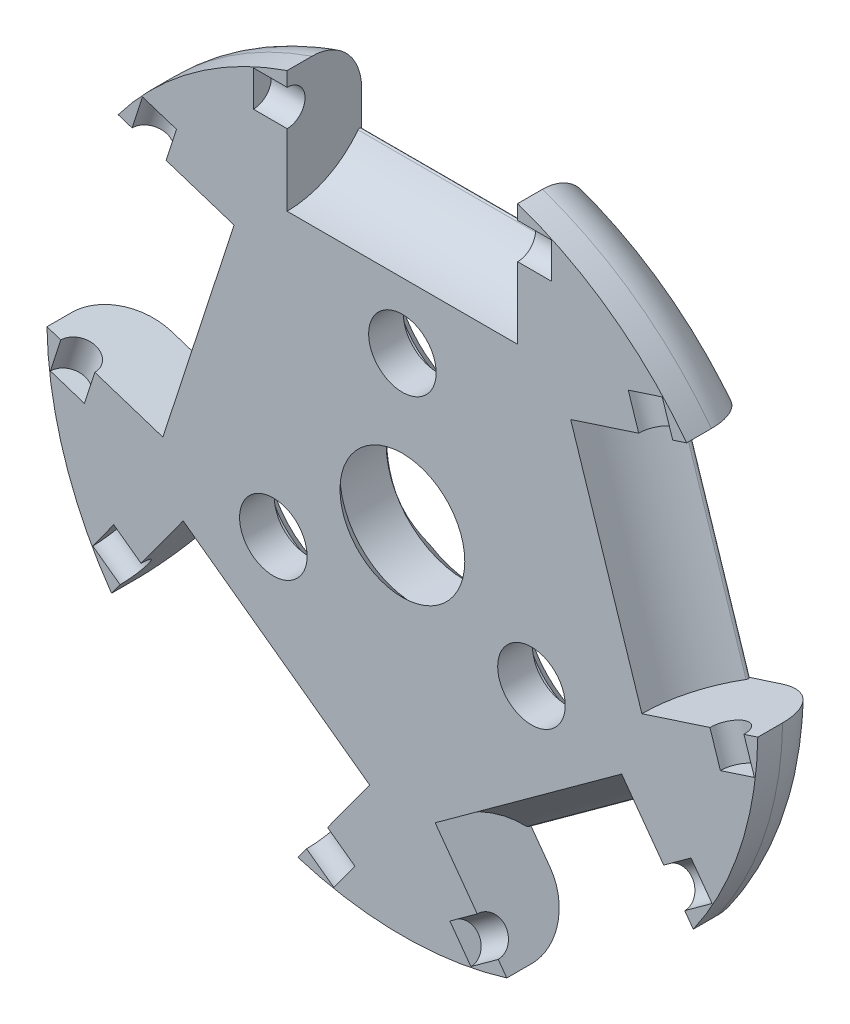
from build123d import *

# Parameters (mm, degrees)
SKETCH1_R                = 22.7203
BOSS_EXTRUDE2_DEPTH      = 4.7625
FILLET1_R                = 3.175
SKETCH2_W                = 14.732
SKETCH2_H                = 10.414
CUT_EXTRUDE2_DEPTH       = 12.7
CIRPATTERN1_COUNT        = 5
SKETCH4_R                = 1.143
CUT_EXTRUDE4_DEPTH       = 9.525
CIRPATTERN2_COUNT        = 5
SKETCH5_R                = 3.96875
CUT_EXTRUDE5_DEPTH       = 33.480350535
SKETCH6_R                = 2.159
CUT_EXTRUDE7_DEPTH       = 33.480350535
BOSS_EXTRUDE4_REACH      = 39.999
FILLET2_R                = 0.127
CIRPATTERN5_COUNT        = 5
FILLET2_OF_CIRPATTERN5_R = 0.127
SKETCH7_R                = 4.445
CUT_EXTRUDE8_DEPTH       = 2.54
SKETCH12_R               = 5.0038
CUT_EXTRUDE9_DEPTH       = 3.9878
CHAMFER1_SIZE            = 0.79375
CHAMFER2_SIZE            = 0.79375


with BuildPart() as part:
    # Sketch1 → Boss-Extrude2 (new body)
    with BuildSketch(Plane.XY):
        Circle(SKETCH1_R)
    extrude(amount=-BOSS_EXTRUDE2_DEPTH)

    # Fillet1
    fillet1_edges = [part.edges().sort_by_distance(p)[0] for p in [
        (-22.7203, 0, -4.7625),
    ]]
    fillet(fillet1_edges, radius=FILLET1_R)

    # Sketch2 → Cut-Extrude2 (cut)
    with BuildSketch(Plane.XY):
        with Locations((0, 18.7833)):
            Rectangle(SKETCH2_W, SKETCH2_H)
    cut_extrude2 = extrude(amount=-CUT_EXTRUDE2_DEPTH, mode=Mode.SUBTRACT)

    # CirPattern1: Cut-Extrude2 ×5 about axis
    cirpattern1_axis = Axis((0, 0, 0), (0, 0, 1))
    for i in range(1, CIRPATTERN1_COUNT):
        add(cut_extrude2.rotate(cirpattern1_axis, i * 360 / CIRPATTERN1_COUNT), mode=Mode.SUBTRACT)

    # Sketch4 → Cut-Extrude4 (cut, symmetric)
    with BuildSketch(Plane(origin=(0, 0, 0), x_dir=(0, 0, -1), z_dir=(1, 0, 0))):
        with Locations((0, 19.4183)):
            Circle(SKETCH4_R)
    cut_extrude4 = extrude(amount=CUT_EXTRUDE4_DEPTH, both=True, mode=Mode.SUBTRACT)

    # CirPattern2: Cut-Extrude4 ×5 about axis
    cirpattern2_axis = Axis((0, 0, 0), (0, 0, 1))
    for i in range(1, CIRPATTERN2_COUNT):
        add(cut_extrude4.rotate(cirpattern2_axis, i * 360 / CIRPATTERN2_COUNT), mode=Mode.SUBTRACT)

    # Sketch5 → Cut-Extrude5 (cut, through all)
    with BuildSketch(Plane.XY):
        Circle(SKETCH5_R)
    extrude(amount=-CUT_EXTRUDE5_DEPTH, mode=Mode.SUBTRACT)

    # Sketch6 → Cut-Extrude7 (cut, through all)
    with BuildSketch(Plane(origin=(0, 0, -4.7625), x_dir=(-1, 0, 0), z_dir=(0, 0, -1))):
        with Locations((0, 9.525)):
            Circle(SKETCH6_R)
        with Locations((8.248891971, -4.7625)):
            Circle(SKETCH6_R)
        with Locations((-8.248891971, -4.7625)):
            Circle(SKETCH6_R)
    extrude(amount=-CUT_EXTRUDE7_DEPTH, mode=Mode.SUBTRACT)

    # Sketch10 → Boss-Extrude4 (add, up to next)
    with BuildSketch(Plane.ZY.offset(-7.366), mode=Mode.PRIVATE) as boss_extrude4_sk1:
        with BuildLine():
            Line((-4.7625, 13.5763), (0, 13.5763))
            Line((0, 13.5763), (0, 13.7033))
            ThreePointArc((0, 13.7033), (-2.7025038, 14.38265722), (-4.7625, 16.259214887))
            Line((-4.7625, 16.259214887), (-4.7625, 13.5763))
        make_face()
    boss_extrude4_tool1 = extrude(boss_extrude4_sk1.sketch, amount=BOSS_EXTRUDE4_REACH, mode=Mode.PRIVATE) - part.part
    boss_extrude4 = boss_extrude4_tool1.solids().sort_by_distance((7.366, 14.314807, -3.452063))[0]
    add(boss_extrude4)

    # Fillet2
    fillet2_edges = [part.edges().sort_by_distance(p)[0] for p in [
        (0, 16.259214887, -4.7625),
    ]]
    fillet(fillet2_edges, radius=FILLET2_R)

    # CirPattern5: Boss-Extrude4 ×5 about axis
    cirpattern5_axis = Axis((0, 0, 0), (0, 0, 1))
    for i in range(1, CIRPATTERN5_COUNT):
        add(boss_extrude4.rotate(cirpattern5_axis, i * 360 / CIRPATTERN5_COUNT))

    # Fillet2 of CirPattern5
    fillet2_of_cirpattern5_edges = [part.edges().sort_by_distance(p)[0] for p in [
        (-15.463432268, 5.024373715, -4.7625),
        (-9.556926725, -13.153981159, -4.7625),
        (9.556926725, -13.153981159, -4.7625),
        (15.463432268, 5.024373715, -4.7625),
    ]]
    fillet(fillet2_of_cirpattern5_edges, radius=FILLET2_OF_CIRPATTERN5_R)

    # Sketch7 → Cut-Extrude8 (cut)
    with BuildSketch(Plane(origin=(0, 0, -4.7625), x_dir=(-1, 0, 0), z_dir=(0, 0, -1))):
        with Locations((8.248891971, -4.7625)):
            Circle(SKETCH7_R)
        with Locations((-8.248891971, -4.7625)):
            Circle(SKETCH7_R)
        with Locations((0, 9.525)):
            Circle(SKETCH7_R)
    extrude(amount=-CUT_EXTRUDE8_DEPTH, mode=Mode.SUBTRACT)

    # Sketch12 → Cut-Extrude9 (cut)
    with BuildSketch(Plane(origin=(0, 0, -4.7625), x_dir=(-1, 0, 0), z_dir=(0, 0, -1))):
        Circle(SKETCH12_R)
    extrude(amount=-CUT_EXTRUDE9_DEPTH, mode=Mode.SUBTRACT)

    # Chamfer1
    # the kernel refuses this chamfer: 0.79375 mm, written as the material it takes off along each edge
    with BuildSketch(Plane(origin=(0, 0, -0.7747), x_dir=(1, 0, 0), z_dir=(0, -1, 0))) as chamfer1_piece_1:
        Polygon((3.96875 + CHAMFER1_SIZE, 0), (3.96875, CHAMFER1_SIZE), (3.96875, 0), align=None)
    revolve(axis=Axis((0, 0, -0.7747), (0, 0, 1)), mode=Mode.SUBTRACT)

    # Chamfer2
    # the kernel refuses this chamfer: 0.79375 mm, written as the material it takes off along each edge
    with BuildSketch(Plane(origin=(0, 9.525, -4.7625), x_dir=(-1, 0, 0), z_dir=(0, -1, 0))) as chamfer2_piece_1:
        Polygon((4.445 + CHAMFER2_SIZE, 0), (4.445, -CHAMFER2_SIZE), (4.445, 0), align=None)
    revolve(axis=Axis((0, 9.525, -4.7625), (0, 0, -1)), mode=Mode.SUBTRACT)
    with BuildSketch(Plane(origin=(8.248891971, -4.7625, -4.7625), x_dir=(-1, 0, 0), z_dir=(0, -1, 0))) as chamfer2_piece_2:
        Polygon((4.445 + CHAMFER2_SIZE, 0), (4.445, -CHAMFER2_SIZE), (4.445, 0), align=None)
    revolve(axis=Axis((8.248891971, -4.7625, -4.7625), (0, 0, -1)), mode=Mode.SUBTRACT)
    with BuildSketch(Plane(origin=(-8.248891971, -4.7625, -4.7625), x_dir=(-1, 0, 0), z_dir=(0, -1, 0))) as chamfer2_piece_3:
        Polygon((4.445 + CHAMFER2_SIZE, 0), (4.445, -CHAMFER2_SIZE), (4.445, 0), align=None)
    revolve(axis=Axis((-8.248891971, -4.7625, -4.7625), (0, 0, -1)), mode=Mode.SUBTRACT)
    with BuildSketch(Plane(origin=(0, 0, -4.7625), x_dir=(-1, 0, 0), z_dir=(0, -1, 0))) as chamfer2_piece_4:
        Polygon((5.0038 + CHAMFER2_SIZE, 0), (5.0038, -CHAMFER2_SIZE), (5.0038, 0), align=None)
    revolve(axis=Axis((0, 0, -4.7625), (0, 0, -1)), mode=Mode.SUBTRACT)


solid = part.part
